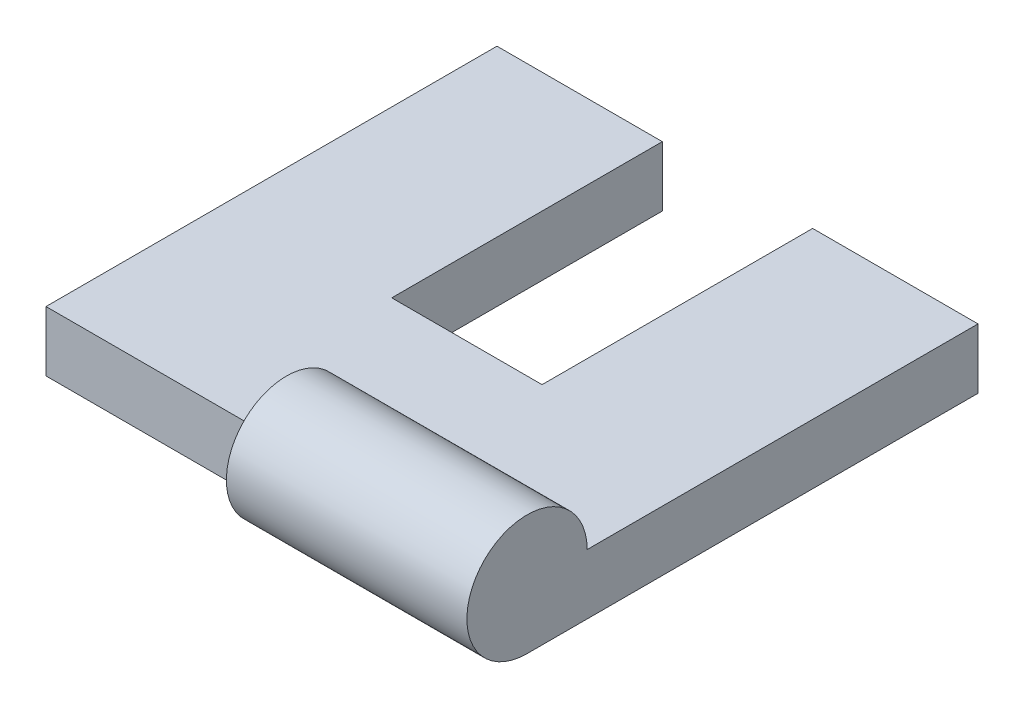
from build123d import *

# Parameters (mm, degrees)
SKETCH1_W           = 16
SKETCH1_H           = 15
BOSS_EXTRUDE1_DEPTH = 2
SKETCH2_R           = 2
BOSS_EXTRUDE2_DEPTH = 8
SKETCH3_W           = 5
SKETCH3_H           = 9
CUT_EXTRUDE1_DEPTH  = 10


with BuildPart() as part:
    # Sketch1 → Boss-Extrude1 (new body)
    with BuildSketch(Plane(origin=(0, 0, 0), x_dir=(1, 0, 0), z_dir=(0, 1, 0))):
        with Locations((10.069631841, -165.54341444)):
            Rectangle(SKETCH1_W, SKETCH1_H)
    extrude(amount=BOSS_EXTRUDE1_DEPTH)

    # Sketch2 → Boss-Extrude2 (add)
    with BuildSketch(Plane(origin=(18.069631841, 0, 0), x_dir=(0, 0, -1), z_dir=(1, 0, 0))):
        with Locations((-173.04341444, 2)):
            Circle(SKETCH2_R)
    extrude(amount=-BOSS_EXTRUDE2_DEPTH)

    # Sketch3 → Cut-Extrude1 (cut)
    with BuildSketch(Plane(origin=(0, 0, 0), x_dir=(-1, 0, 0), z_dir=(0, -1, 0))):
        with Locations((-10.069631841, -162.54341444)):
            Rectangle(SKETCH3_W, SKETCH3_H)
    extrude(amount=-CUT_EXTRUDE1_DEPTH, mode=Mode.SUBTRACT)


solid = part.part
